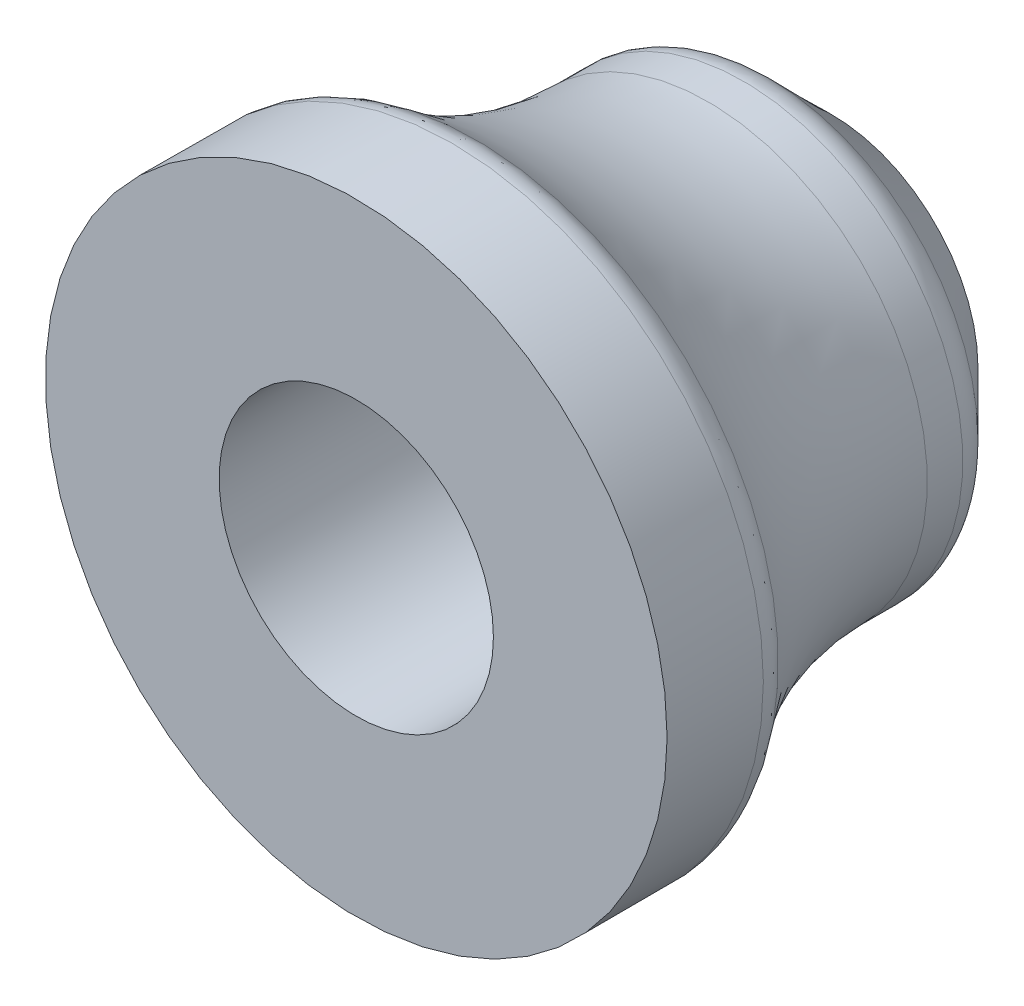
from build123d import *

# Parameters (mm, degrees)
ESBO_O1_R                = 6
RESSALTO_EXTRUS_O1_DEPTH = 13
CORTE_EXTRUS_O1_DEPTH    = 12
ESBO_O3_R                = 3.75
CORTE_EXTRUS_O2_DEPTH    = 10
CHANFRO1_SIZE            = 2
ESBO_O4_R                = 8.5
ESBO_O4_R_2              = 3.75
RESSALTO_EXTRUS_O2_DEPTH = 3
FILETE1_R                = 10
FILETE3_R                = 1
CORTE_EXTRUS_O3_DEPTH    = 0.2


with BuildPart() as part:
    # Esboço1 → Ressalto-extrusão1 (new body)
    with BuildSketch(Plane.XY):
        with Locations(Location((0, 0, 0), (0, 0, 180))):
            Circle(ESBO_O1_R)
    extrude(amount=RESSALTO_EXTRUS_O1_DEPTH)

    # Esboço2 → Corte-extrusão1 (cut)
    with BuildSketch(Plane.XY.offset(13)):
        with BuildLine():
            Line((2.683281573, 1.45), (-2.683281573, 1.45))
            ThreePointArc((-2.683281573, 1.45), (-0.747827254, -2.956899457), (3.05, 0))
            ThreePointArc((3.05, 0), (2.956899457, 0.747827254), (2.683281573, 1.45))
        make_face()
    extrude(amount=-CORTE_EXTRUS_O1_DEPTH, mode=Mode.SUBTRACT)

    # Esboço3 → Corte-extrusão2 (cut)
    with BuildSketch(Plane.XY.offset(13)):
        Circle(ESBO_O3_R)
    extrude(amount=-CORTE_EXTRUS_O2_DEPTH, mode=Mode.SUBTRACT)

    # Chanfro1
    chanfro1_edges = [part.edges().sort_by_distance(p)[0] for p in [
        (6, 0, 0),
    ]]
    chamfer(chanfro1_edges, length=CHANFRO1_SIZE)

    # Esboço4 → Ressalto-extrusão2 (add)
    with BuildSketch(Plane.XY.offset(13)):
        Circle(ESBO_O4_R)
        Circle(ESBO_O4_R_2, mode=Mode.SUBTRACT)
    extrude(amount=-RESSALTO_EXTRUS_O2_DEPTH)

    # Filete1
    # the kernel refuses this fillet: 10 mm, written as the material it adds along each edge
    with BuildSketch(Plane(origin=(0, 0, 10), x_dir=(-1, 0, 0), z_dir=(0, -1, 0))) as filete1_piece_1:
        with BuildLine():
            CenterArc((16, 6.614378278), FILETE1_R, 180, 41.409622109)
            Line((8.5, 0), (6, 0))
            Line((6, 0), (6, 6.614378278))
        make_face()
    revolve(axis=Axis((0, 0, 10), (0, 0, -1)))

    # Filete3
    filete3_edges = [part.edges().sort_by_distance(p)[0] for p in [
        (6, 0, 2),
        (0, 8.5, 10),
    ]]
    fillet(filete3_edges, radius=FILETE3_R)

    # Esboço5 → Corte-extrusão3 (cut)
    with BuildSketch(Plane(origin=(0, 0, 0), x_dir=(-1, 0, 0), z_dir=(0, 0, -1))):
        Polygon((-2.631008166, 3.012938106), (-2.631008166, -3.012938106), (-0.875588874, -3.012938106), (-0.875588874, -0.877709646), (0.761455767, -3.012938106), (2.51687506, -3.012938106), (0.206904827, 0), (2.51687506, 3.012938106), (0.761455767, 3.012938106), (-0.875588874, 0.877709646), (-0.875588874, 3.012938106), align=None)
    extrude(amount=-CORTE_EXTRUS_O3_DEPTH, mode=Mode.SUBTRACT)


solid = part.part
